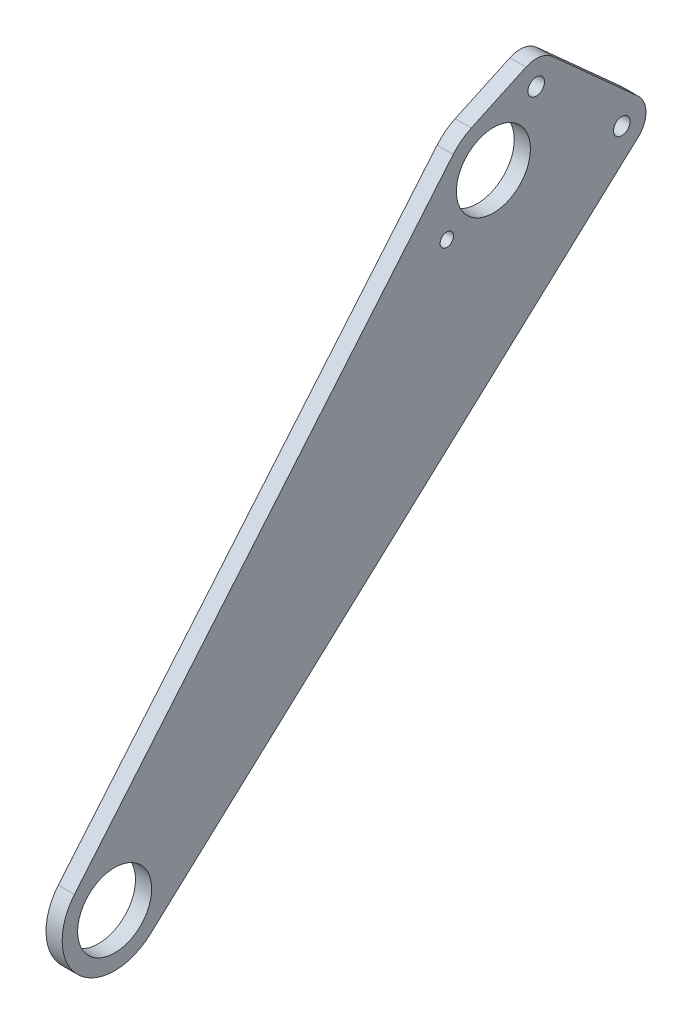
from build123d import *

# Parameters (mm, degrees)
SKETCH1_R           = 14.5542
SKETCH1_R_2         = 3.2639
SKETCH1_R_3         = 2.6289
BOSS_EXTRUDE1_DEPTH = 6.35


with BuildPart() as part:
    # Sketch1 → Boss-Extrude1 (new body)
    with BuildSketch(Plane(origin=(0, 0, 0), x_dir=(0, 0, -1), z_dir=(1, 0, 0))):
        with BuildLine():
            Line((-15.81059753, 13.263913901), (133.153358593, 190.829086165))
            ThreePointArc((133.153358593, 190.829086165), (136.413649914, 193.947974842), (140.273805793, 196.283817874))
            Line((140.273805793, 196.283817874), (161.788085153, 206.271844026))
            ThreePointArc((161.788085153, 206.271844026), (167.21418736, 207.051739481), (172.171515343, 204.711713553))
            Line((172.171515343, 204.711713553), (205.812262342, 174.428998606))
            ThreePointArc((205.812262342, 174.428998606), (208.964596209, 167.387441015), (205.86808218, 160.321158896))
            Line((205.86808218, 160.321158896), (13.92822473, -15.22862312))
            ThreePointArc((13.92822473, -15.22862312), (-14.277324621, -14.901825658), (-15.81059753, 13.263913901))
        make_face()
        Circle(SKETCH1_R, mode=Mode.SUBTRACT)
        with Locations((148.963956123, 177.565172264)):
            Circle(SKETCH1_R, mode=Mode.SUBTRACT)
        with Locations((199.439670766, 167.349754182)):
            Circle(SKETCH1_R_2, mode=Mode.SUBTRACT)
        with Locations((165.798923767, 197.632469129)):
            Circle(SKETCH1_R_2, mode=Mode.SUBTRACT)
        with Locations((130.638344472, 163.06901389)):
            Circle(SKETCH1_R_3, mode=Mode.SUBTRACT)
    extrude(amount=BOSS_EXTRUDE1_DEPTH)


solid = part.part
